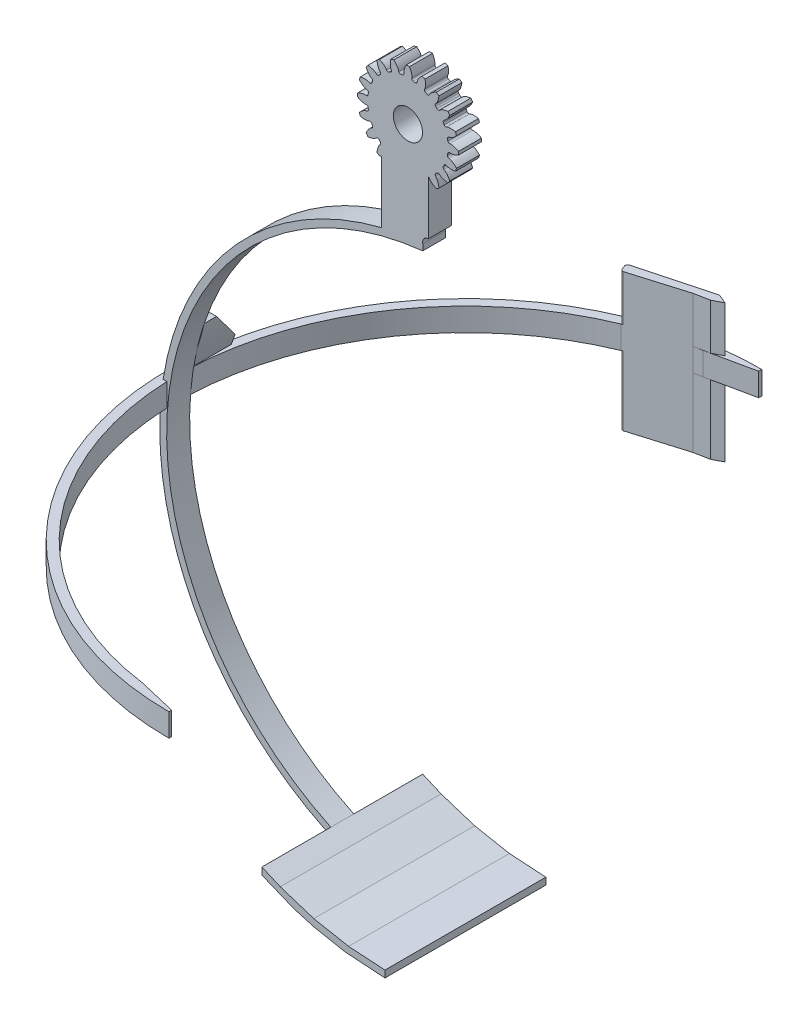
from build123d import *

# Parameters (mm, degrees)
SKETCH_1_R                      = 22
LASHENA_DEPTH                   = 10
CUT_EXTRUDEA_DEPTH              = 10
WWW_KYTOOL_CN_COUNT             = 20
CUT_EXTRUDE_1_REACH             = 34.68
SKETCH_3_R                      = 6.35
EXTRUDE_7_DEPTH                 = 10
SKETCH_5_W                      = 1.52117686
SKETCH_5_H                      = 2
EXTRUDE_8_DEPTH                 = 1
EXTRUDE_9_DEPTH                 = 5
EXTRUDE_9_DEPTH_BACK            = 5
CUT_EXTRUDE_2_REACH             = 248.945
CUT_EXTRUDE_2_DIRECTION_2_REACH = 248.945
CUT_EXTRUDE_3_REACH             = 248.945
CUT_EXTRUDE_3_DIRECTION_2_REACH = 248.945
EXTRUDE_10_DEPTH                = 30
EXTRUDE_10_DEPTH_BACK           = 30
FILLET_1_R                      = 1
FILLET_2_R                      = 1
EXTRUDE_11_DEPTH                = 20
CUT_EXTRUDE_5_DEPTH             = 20
CUT_EXTRUDE_6_DEPTH             = 20
EXTRUDE_12_DEPTH                = 30
EXTRUDE_12_DEPTH_BACK           = 40
SKETCH_17_R                     = 2.5
CUT_EXTRUDE_7_DEPTH             = 30
SKETCH_18_W                     = 18.815354705
SKETCH_18_H                     = 13.59877532
CUT_EXTRUDE_8_DEPTH             = 30
SKETCH_19_W                     = 10.614174499
SKETCH_19_H                     = 5.44636462
CUT_EXTRUDE_9_DEPTH             = 30
CUT_EXTRUDE_10_DEPTH            = 0.1


with BuildPart() as part:
    # 草图1 → LaShenA (new body)
    with BuildSketch(Plane.XY):
        Circle(SKETCH_1_R)
    extrude(amount=LASHENA_DEPTH)

    # SketchA → Cut-ExtrudeA (cut)
    with BuildSketch(Plane.XY.offset(10)):
        with BuildLine():
            ThreePointArc((7.103559199, 21.924886291), (3.605334877, 22.763188542), (0.019276198, 23.046926489))
            add(Edge.make_bspline(
                [(1.702150265, 18.166232554), (1.719688148, 18.349191849), (1.753017983, 18.587187115), (1.755032138, 18.854430779), (1.748119105, 18.96858568), (1.740442532, 19.059314632), (1.728648187, 19.16371233), (1.712100501, 19.281625912), (1.690016545, 19.412858516), (1.661670688, 19.557187029), (1.626329749, 19.714356663), (1.583275034, 19.88408306), (1.531796904, 20.066052064), (1.471197858, 20.259920271), (1.400793, 20.465315382), (1.31991127, 20.681836671), (1.227896436, 20.90905546), (1.124108127, 21.146515641), (1.007922835, 21.393734229), (0.87873492, 21.650201949), (0.735957506, 21.915383862), (0.579023699, 22.188719998), (0.345304887, 22.571230486), (0.154233644, 22.856446723), (0.019276198, 23.046926489)],
                knots=[0.125068197, 0.125068197, 0.125068197, 0.125068197, 0.215847125, 0.244833276, 0.257593391, 0.272673526, 0.290073681, 0.309793857, 0.331834054, 0.356194271, 0.382874509, 0.411874767, 0.443195046, 0.476835345, 0.512795666, 0.551076006, 0.591676368, 0.634596749, 0.679837152, 0.727397575, 0.777278019, 0.829478483, 0.883998968, 1, 1, 1, 1], degree=3))
            ThreePointArc((1.702150265, 18.166232554), (1.86301882, 17.621713019), (2.356349611, 17.340634836))
            ThreePointArc((2.356349611, 17.340634836), (2.737603138, 17.28454596), (3.117529205, 17.220075832))
            ThreePointArc((3.117529205, 17.220075832), (3.673572605, 17.334949471), (3.994833481, 17.803107206))
            add(Edge.make_bspline(
                [(3.994833481, 17.803107206), (4.034691495, 17.98253134), (4.076537521, 18.219177773), (4.157204778, 18.47396401), (4.199055268, 18.580395528), (4.234392911, 18.664311698), (4.277870663, 18.759955155), (4.330045748, 18.866984119), (4.391601943, 18.984969425), (4.463160419, 19.113474646), (4.545339737, 19.2520309), (4.638735544, 19.400145657), (4.743925671, 19.557300848), (4.861467358, 19.722954334), (4.991896938, 19.896540395), (5.135728792, 20.077470549), (5.293454567, 20.265134311), (5.465542346, 20.458900012), (5.65243587, 20.658115632), (5.854553762, 20.862109666), (6.07228887, 21.070192005), (6.3060073, 21.281654905), (6.646489341, 21.573220913), (6.916345556, 21.785433413), (7.103559199, 21.924886291)],
                knots=[0.125068197, 0.125068197, 0.125068197, 0.125068197, 0.215847125, 0.244833276, 0.257593391, 0.272673526, 0.290073681, 0.309793857, 0.331834054, 0.356194271, 0.382874509, 0.411874767, 0.443195046, 0.476835345, 0.512795666, 0.551076006, 0.591676368, 0.634596749, 0.679837152, 0.727397575, 0.777278019, 0.829478483, 0.883998968, 1, 1, 1, 1], degree=3))
        make_face()
    cut_extrudea = extrude(amount=-CUT_EXTRUDEA_DEPTH, mode=Mode.SUBTRACT)

    # www.KYTool.cn: Cut-ExtrudeA ×20 about axis
    www_kytool_cn_axis = Axis((0, 0, -88.99), (0, 0, 1))
    for i in range(1, WWW_KYTOOL_CN_COUNT):
        add(cut_extrudea.rotate(www_kytool_cn_axis, i * 360 / WWW_KYTOOL_CN_COUNT), mode=Mode.SUBTRACT)

    # 草图3 → 切除-拉伸1 (cut, up to next)
    with BuildSketch(Plane.XY.offset(10), mode=Mode.PRIVATE) as cut_extrude_1_sk1:
        Circle(SKETCH_3_R)
    cut_extrude_1_tool1 = extrude(cut_extrude_1_sk1.sketch, amount=-CUT_EXTRUDE_1_REACH, mode=Mode.PRIVATE) & part.part
    add(cut_extrude_1_tool1.solids().sort_by_distance((0, 0, 10))[0], mode=Mode.SUBTRACT)

    # 草图4 → 凸台-拉伸7 (add)
    with BuildSketch(Plane.XY.offset(10)):
        with BuildLine():
            Line((20, -43.819430161), (20, -40.819430161))
            ThreePointArc((20, -40.819430161), (14.43628771, -40.940404885), (8.883092116, -41.303100387))
            Line((8.883092116, -41.303100387), (8.883092116, -14.749097253))
            Line((8.883092116, -14.749097253), (-11.473043895, -14.749097253))
            Line((-11.473043895, -14.749097253), (-11.473043895, -44.749097253))
            ThreePointArc((-11.473043895, -44.749097253), (-107.013783922, -184.678140508), (20, -296.819430161))
            Line((20, -296.819430161), (20, -293.819430161))
            ThreePointArc((20, -293.819430161), (-105, -168.819430161), (20, -43.819430161))
        make_face()
    extrude(amount=-EXTRUDE_7_DEPTH)

    # 草图5 → 凸台-拉伸8 (add)
    with BuildSketch(Plane.XY.offset(10)):
        with Locations((-106.600364459, -154.47914774)):
            Rectangle(SKETCH_5_W, SKETCH_5_H)
    extrude(amount=EXTRUDE_8_DEPTH)

    # 草图6 → 凸台-拉伸9 (add, two sides: drawn at the far end of the back side and taken through both)
    with BuildSketch(Plane(origin=(0, -154.47914774, 0), x_dir=(-1, 0, 0), z_dir=(0, -1, 0)).offset(-EXTRUDE_9_DEPTH_BACK)):
        with BuildLine():
            Line((-20, 124), (-20, 120))
            ThreePointArc((-20, 120), (105, -5), (-20, -130))
            Line((-20, -130), (-20, -134))
            ThreePointArc((-20, -134), (109, -5), (-20, 124))
        make_face()
    extrude(amount=EXTRUDE_9_DEPTH + EXTRUDE_9_DEPTH_BACK)

    # 草图7 → 切除-拉伸2 (cut, up to next)
    with BuildSketch(Plane(origin=(0, -154.47914774, 0), x_dir=(-1, 0, 0), z_dir=(0, -1, 0)), mode=Mode.PRIVATE) as cut_extrude_2_sk1:
        Polygon((-20, -132.826433028), (-1.866505247, -128.523084893), (-20, -128.932236927), align=None)
    cut_extrude_2_tool1 = extrude(cut_extrude_2_sk1.sketch, amount=-CUT_EXTRUDE_2_REACH, mode=Mode.PRIVATE) & part.part
    add(cut_extrude_2_tool1.solids().sort_by_distance((13.955502, -154.479148, 130.093918))[0], mode=Mode.SUBTRACT)

    # 草图7 → 切除-拉伸2 direction 2 (cut, up to next)
    with BuildSketch(Plane(origin=(0, -154.47914774, 0), x_dir=(-1, 0, 0), z_dir=(0, -1, 0)), mode=Mode.PRIVATE) as cut_extrude_2_direction_2_sk1:
        Polygon((-20, -132.826433028), (-1.866505247, -128.523084893), (-20, -128.932236927), align=None)
    cut_extrude_2_direction_2_tool1 = extrude(cut_extrude_2_direction_2_sk1.sketch, amount=CUT_EXTRUDE_2_DIRECTION_2_REACH, mode=Mode.PRIVATE) & part.part
    add(cut_extrude_2_direction_2_tool1.solids().sort_by_distance((13.955502, -154.479148, 130.093918))[0], mode=Mode.SUBTRACT)

    # 草图8 → 切除-拉伸3 (cut, up to next)
    with BuildSketch(Plane(origin=(0, -154.47914774, 0), x_dir=(-1, 0, 0), z_dir=(0, -1, 0)), mode=Mode.PRIVATE) as cut_extrude_3_sk1:
        Polygon((-20, 122.66134933), (0, 118.389626793), (-20, 116.050208339), align=None)
    cut_extrude_3_tool1 = extrude(cut_extrude_3_sk1.sketch, amount=-CUT_EXTRUDE_3_REACH, mode=Mode.PRIVATE) & part.part
    add(cut_extrude_3_tool1.solids().sort_by_distance((13.333333, -154.479148, -119.033728))[0], mode=Mode.SUBTRACT)

    # 草图8 → 切除-拉伸3 direction 2 (cut, up to next)
    with BuildSketch(Plane(origin=(0, -154.47914774, 0), x_dir=(-1, 0, 0), z_dir=(0, -1, 0)), mode=Mode.PRIVATE) as cut_extrude_3_direction_2_sk1:
        Polygon((-20, 122.66134933), (0, 118.389626793), (-20, 116.050208339), align=None)
    cut_extrude_3_direction_2_tool1 = extrude(cut_extrude_3_direction_2_sk1.sketch, amount=CUT_EXTRUDE_3_DIRECTION_2_REACH, mode=Mode.PRIVATE) & part.part
    add(cut_extrude_3_direction_2_tool1.solids().sort_by_distance((13.333333, -154.479148, -119.033728))[0], mode=Mode.SUBTRACT)

    # 草图10 → 凸台-拉伸10 (add, two sides: drawn at the far end of the back side and taken through both)
    with BuildSketch(Plane.XZ.offset(159.47914774).offset(-EXTRUDE_10_DEPTH_BACK)):
        Polygon((-3.683292696, -117.73590203), (2.76409072, -118.979998224), (6.807939671, -121.106364224), (2.76409072, -122.843355053), (-29.326630728, -114.196826724), (-27.797122798, -110.500801089), align=None)
    extrude(amount=EXTRUDE_10_DEPTH + EXTRUDE_10_DEPTH_BACK)

    # 圆角1
    fillet_1_edges = [part.edges().sort_by_distance(p)[0] for p in [
        (-29.326630728, -139.47914774, -114.196826724),
        (-29.326630728, -174.47914774, -114.196826724),
    ]]
    fillet(fillet_1_edges, radius=FILLET_1_R)

    # 圆角2
    fillet_2_edges = [part.edges().sort_by_distance(p)[0] for p in [
        (-27.797122798, -139.47914774, -110.500801089),
        (-27.797122798, -174.47914774, -110.500801089),
    ]]
    fillet(fillet_2_edges, radius=FILLET_2_R)

    # 草图12 → 凸台-拉伸11 (add)
    with BuildSketch(Plane(origin=(0, -149.47914774, 0), x_dir=(1, 0, 0), z_dir=(0, 1, 0))):
        Polygon((-106.933053221, 18), (-106.530444858, 0), (-90.017661953, 0), (-90.017661953, 18), align=None)
    extrude(amount=EXTRUDE_11_DEPTH)

    # 草图13 → 切除-拉伸5 (cut)
    with BuildSketch(Plane.XY):
        with BuildLine():
            Line((-106.530444858, -129.47914774), (-101.80452446, -129.47914774))
            add(Edge.make_bspline(
                [(-101.80452446, -129.47914774), (-103.911889063, -136.002203275), (-105.494801039, -142.70241422), (-106.530444858, -149.47914774)],
                knots=[0, 0, 0, 0, 1, 1, 1, 1], degree=3))
            Line((-106.530444858, -149.47914774), (-106.530444858, -129.47914774))
        make_face()
        with BuildLine():
            Line((-98.647975874, -129.47914774), (-90.017661953, -129.47914774))
            Line((-90.017661953, -129.47914774), (-90.017661953, -149.47914774))
            Line((-90.017661953, -149.47914774), (-104.895509075, -149.47914774))
            add(Edge.make_bspline(
                [(-98.647975874, -129.47914774), (-101.117690573, -139.686034191), (-104.895509075, -149.47914774)],
                knots=[0, 0, 0, 1, 1, 1], degree=2))
        make_face()
    extrude(amount=-CUT_EXTRUDE_5_DEPTH, mode=Mode.SUBTRACT)

    # 草图14 → 切除-拉伸6 (cut)
    with BuildSketch(Plane.ZY.offset(109)):
        Polygon((-5.346597925, -129.47914774), (-18, -144.905214807), (-18, -129.47914774), align=None)
    extrude(amount=-CUT_EXTRUDE_6_DEPTH, mode=Mode.SUBTRACT)

    # 草图16 → 凸台-拉伸12 (add, two sides: drawn at the far end of the back side and taken through both)
    with BuildSketch(Plane.XY.offset(10).offset(-EXTRUDE_12_DEPTH_BACK)):
        Polygon((-33.559799687, -281.763433355), (-33.559799687, -284.812033834), (-19.566291139, -290.550726899), (-10.734087733, -293.074876123), (2.799837395, -295.658518799), (20, -296.819430161), (20, -293.819430161), (4.157332583, -292.811405261), (-10.947306143, -289.92791146), (-25.554814741, -285.222861614), align=None)
    extrude(amount=EXTRUDE_12_DEPTH + EXTRUDE_12_DEPTH_BACK)

    # 草图17 → 切除-拉伸7 (cut)
    with BuildSketch(Plane.XY.offset(10)):
        with Locations((8.883092116, -41.303100387)):
            Circle(SKETCH_17_R)
    extrude(amount=-CUT_EXTRUDE_7_DEPTH, mode=Mode.SUBTRACT)

    # 草图18 → 切除-拉伸8 (cut)
    with BuildSketch(Plane.XY.offset(10)):
        with Locations((22.067478431, -43.269928208)):
            Rectangle(SKETCH_18_W, SKETCH_18_H)
    extrude(amount=-CUT_EXTRUDE_8_DEPTH, mode=Mode.SUBTRACT)

    # 草图19 → 切除-拉伸9 (cut)
    with BuildSketch(Plane.XY.offset(10)):
        with Locations((11.761330349, -43.434089775)):
            Rectangle(SKETCH_19_W, SKETCH_19_H)
    extrude(amount=-CUT_EXTRUDE_9_DEPTH, mode=Mode.SUBTRACT)

    # 草图21 → 切除-拉伸10 (cut)
    with BuildSketch(Plane(origin=(-106.477175544, 0, 2.381588966), x_dir=(0.022361538387884978, 0, 0.9997499495378468), z_dir=(-0.9997499495378468, 0, 0.022361538387884978))):
        Polygon((-21.931255682, -128.300969422), (-20.386686666, -149.47914774), (-2.382184632, -149.47914774), (-2.252960541, -126.357051738), align=None)
    extrude(amount=-CUT_EXTRUDE_10_DEPTH, mode=Mode.SUBTRACT)


solid = part.part
